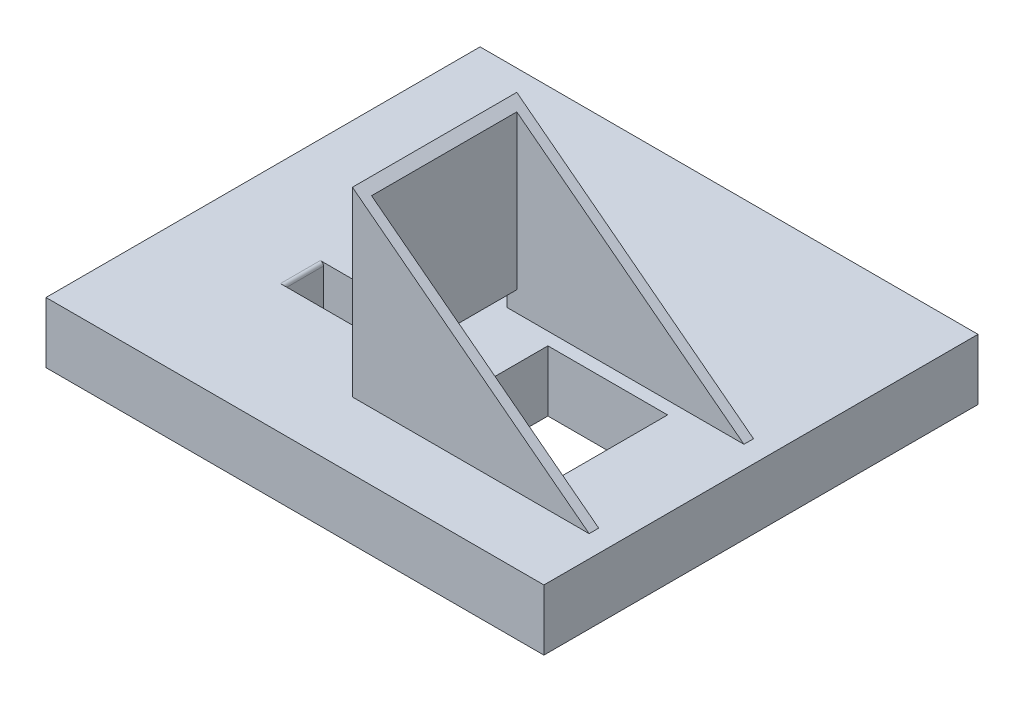
from build123d import *

# Parameters (mm, degrees)
SKETCH1_W             = 156
SKETCH1_H             = 136
BOSS_EXTRUDE1_DEPTH   = 19.05
SKETCH2_W             = 37.5
SKETCH2_H             = 37.5
CUT_EXTRUDE1_DEPTH    = 106.218356288
SKETCH3_W             = 22.8
SKETCH3_H             = 12.5
CUT_EXTRUDE2_DEPTH    = 106.218356288
FILLET1_R             = 1
BOSS_EXTRUDE2_START   = -4.5
BOSS_EXTRUDE2_DEPTH   = 51.5
BOSS_EXTRUDE2_2_DEPTH = 3
BOSS_EXTRUDE2_START_2 = 44
BOSS_EXTRUDE2_3_DEPTH = 3
CUT_EXTRUDE3_REACH    = 130.365
SKETCH5_W             = 45.5
SKETCH5_H             = 6.35


# Read off the part's stored shape, not the designer's step: Boss-Extrude2
with BuildPart() as part:
    # Sketch1 → Boss-Extrude1 (new body)
    with BuildSketch(Plane(origin=(0, 0, 0), x_dir=(1, 0, 0), z_dir=(0, 1, 0))):
        Rectangle(SKETCH1_W, SKETCH1_H)
    extrude(amount=BOSS_EXTRUDE1_DEPTH)

    # Sketch2 → Cut-Extrude1 (cut, through all)
    with BuildSketch(Plane(origin=(0, 19.05, 0), x_dir=(1, 0, 0), z_dir=(0, 1, 0))):
        with Locations((32.5, -21.25)):
            Rectangle(SKETCH2_W, SKETCH2_H)
    extrude(amount=-CUT_EXTRUDE1_DEPTH, mode=Mode.SUBTRACT)

    # Sketch3 → Cut-Extrude2 (cut, through all)
    with BuildSketch(Plane(origin=(0, 19.05, 0), x_dir=(1, 0, 0), z_dir=(0, 1, 0))):
        with Locations((-32.65, -21.25)):
            Rectangle(SKETCH3_W, SKETCH3_H)
    extrude(amount=-CUT_EXTRUDE2_DEPTH, mode=Mode.SUBTRACT)

    # Fillet1
    fillet1_edges = [part.edges().sort_by_distance(p)[0] for p in [
        (-44.05, 19.05, 21.25),
        (-21.25, 19.05, 21.25),
    ]]
    fillet(fillet1_edges, radius=FILLET1_R)

    # Boss-Extrude2 outline → Boss-Extrude2 (add)
    with BuildSketch(Plane.XY.offset(BOSS_EXTRUDE2_START)):
        Polygon((-3, 19.05), (0, 19.05), (0, 73.655885813), (-3, 75.957866777), align=None)
    extrude(amount=BOSS_EXTRUDE2_DEPTH)

    # Boss-Extrude2 2 outline → Boss-Extrude2 2 (add)
    with BuildSketch(Plane.XY.offset(BOSS_EXTRUDE2_START)):
        Polygon((0, 73.655885813), (0, 19.05), (71.163775898, 19.05), align=None)
    extrude(amount=BOSS_EXTRUDE2_2_DEPTH)

    # Boss-Extrude2 3 outline → Boss-Extrude2 3 (add)
    with BuildSketch(Plane.XY.offset(BOSS_EXTRUDE2_START_2)):
        Polygon((0, 73.655885813), (0, 19.05), (71.163775898, 19.05), align=None)
    extrude(amount=BOSS_EXTRUDE2_3_DEPTH)

    # Sketch5 → Cut-Extrude3 (cut, up to next)
    with BuildSketch(Plane(origin=(0, 0, 0), x_dir=(0, 0, -1), z_dir=(1, 0, 0)), mode=Mode.PRIVATE) as cut_extrude3_sk1:
        with Locations((-21.25, 22.225)):
            Rectangle(SKETCH5_W, SKETCH5_H)
    cut_extrude3_tool1 = extrude(cut_extrude3_sk1.sketch, amount=-CUT_EXTRUDE3_REACH, mode=Mode.PRIVATE) & part.part
    add(cut_extrude3_tool1.solids().sort_by_distance((0, 22.225, 21.25))[0], mode=Mode.SUBTRACT)


solid = part.part
